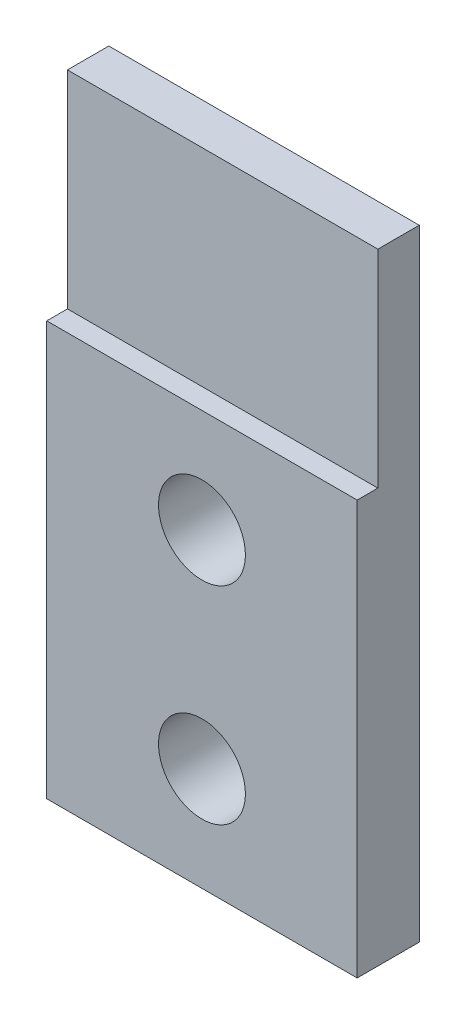
from build123d import *

# Parameters (mm, degrees)
SKETCH_1_W          = 30
SKETCH_1_H          = 60
SKETCH_1_R          = 4.2
EXTRUDE_1_DEPTH     = 6
SKETCH_2_W          = 2
SKETCH_2_H          = 20
CUT_EXTRUDE_1_DEPTH = 43.848570571


with BuildPart() as part:
    # Эскиз1 → Бобышка-Вытянуть1 (new body)
    with BuildSketch(Plane.XY):
        Rectangle(SKETCH_1_W, SKETCH_1_H)
        with Locations((0, -20)):
            Circle(SKETCH_1_R, mode=Mode.SUBTRACT)
        Circle(SKETCH_1_R, mode=Mode.SUBTRACT)
    extrude(amount=EXTRUDE_1_DEPTH)

    # Эскиз2 → Вырез-Вытянуть1 (cut, through all)
    with BuildSketch(Plane.ZY.offset(-15)):
        with Locations((5, 20)):
            Rectangle(SKETCH_2_W, SKETCH_2_H)
    extrude(amount=CUT_EXTRUDE_1_DEPTH, mode=Mode.SUBTRACT)


solid = part.part
